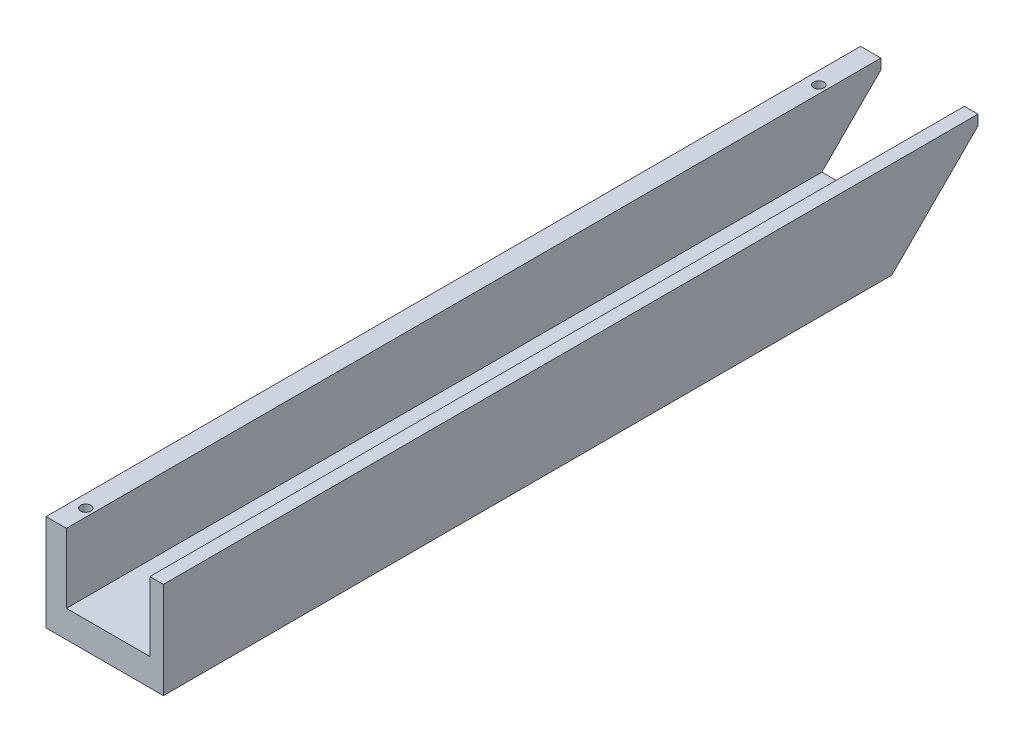
from build123d import *

# Parameters (mm, degrees)
RAIL_EXTRUDE_DEPTH = 120
SKETCH2_R          = 0.75
FIRST_HOLE_DEPTH   = 123.068100465
SKETCH3_R          = 0.75
LAST_HOLE_DEPTH    = 123.068100465
ANGLE_DEPTH        = 122.467557817


with BuildPart() as part:
    # Sketch1 → Rail-Extrude (new body)
    with BuildSketch(Plane.XY):
        Polygon((-0.008928571, 6.778571429), (2.991071429, 6.778571429), (2.991071429, -3.421428571), (15.291071429, -3.421428571), (15.291071429, 6.778571429), (17.291071429, 6.778571429), (17.291071429, -7.421428571), (-0.008928571, -7.421428571), align=None)
    extrude(amount=RAIL_EXTRUDE_DEPTH)

    # Sketch2 → First Hole (cut, through all)
    with BuildSketch(Plane(origin=(0, 6.778571429, 0), x_dir=(1, 0, 0), z_dir=(0, 1, 0))):
        with Locations((1.841071429, -8)):
            Circle(SKETCH2_R)
    extrude(amount=-FIRST_HOLE_DEPTH, mode=Mode.SUBTRACT)

    # Sketch3 → Last Hole (cut, through all)
    with BuildSketch(Plane(origin=(0, 6.778571429, 0), x_dir=(1, 0, 0), z_dir=(0, 1, 0))):
        with Locations((1.841071429, -116)):
            Circle(SKETCH3_R)
    extrude(amount=-LAST_HOLE_DEPTH, mode=Mode.SUBTRACT)

    # Sketch5 → Angle (cut, through all)
    with BuildSketch(Plane.ZY.offset(0.008928571)):
        Polygon((12.7, -7.421428571), (0, 5.278571429), (0, -7.421428571), align=None)
    extrude(amount=-ANGLE_DEPTH, mode=Mode.SUBTRACT)


solid = part.part
